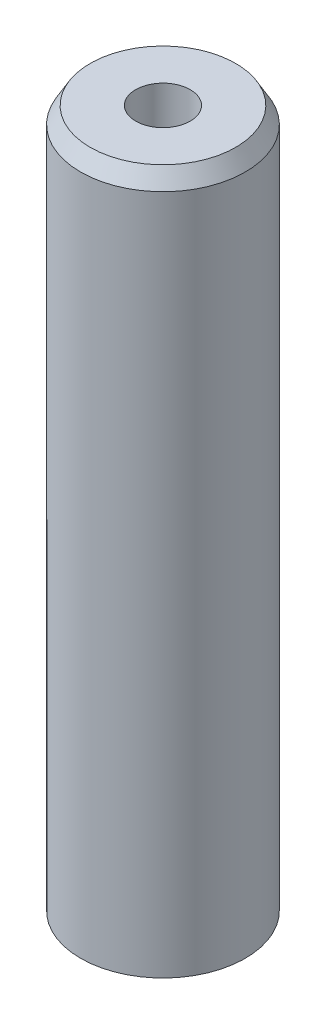
from build123d import *
from OCP.BRepFilletAPI import BRepFilletAPI_MakeChamfer

# Parameters (mm, degrees)
SKETCH1_R           = 15
BOSS_EXTRUDE1_DEPTH = 128.851055355
SKETCH2_R           = 4.973276784
CUT_EXTRUDE1_DEPTH  = 131.585582918
CHAMFER1_SIZE       = 3.021189383
CHAMFER1_SIZE2      = 1.744284503


with BuildPart() as part:
    # Sketch1 → Boss-Extrude1 (new body)
    with BuildSketch(Plane(origin=(0, 0, 0), x_dir=(1, 0, 0), z_dir=(0, 1, 0))):
        Circle(SKETCH1_R)
    extrude(amount=BOSS_EXTRUDE1_DEPTH)

    # Sketch2 → Cut-Extrude1 (cut, through all)
    with BuildSketch(Plane(origin=(0, 0, 0), x_dir=(1, 0, 0), z_dir=(0, 1, 0))):
        Circle(SKETCH2_R)
    extrude(amount=CUT_EXTRUDE1_DEPTH, mode=Mode.SUBTRACT)

    # Chamfer1: one chamfer whose edges measure the first distance from different faces: ONE call of the kernel's chamfer builder (chamfer() names one face for all edges)
    chamfer1_edges_1 = [part.edges().sort_by_distance(p)[0] for p in [
        (-15, 128.851055355, 0),
    ]]
    chamfer1_side_1 = [part.faces().sort_by_distance(p)[0] for p in [
        (-15, 64.425527678, 0),
    ]]
    chamfer1_edges_2 = [part.edges().sort_by_distance(p)[0] for p in [
        (-15, 0, 0),
    ]]
    chamfer1_side_2 = [part.faces().sort_by_distance(p)[0] for p in [
        (-14.575735931, 0, 0),
    ]]
    chamfer1 = BRepFilletAPI_MakeChamfer(part.part.solid().wrapped)
    for e in chamfer1_edges_1:
        chamfer1.Add(CHAMFER1_SIZE, CHAMFER1_SIZE2, e.wrapped, chamfer1_side_1[0].wrapped)  # the first distance lies on this face
    for e in chamfer1_edges_2:
        chamfer1.Add(CHAMFER1_SIZE, CHAMFER1_SIZE2, e.wrapped, chamfer1_side_2[0].wrapped)  # the first distance lies on this face
    add(Compound.cast(chamfer1.Shape()), mode=Mode.REPLACE)


solid = part.part
